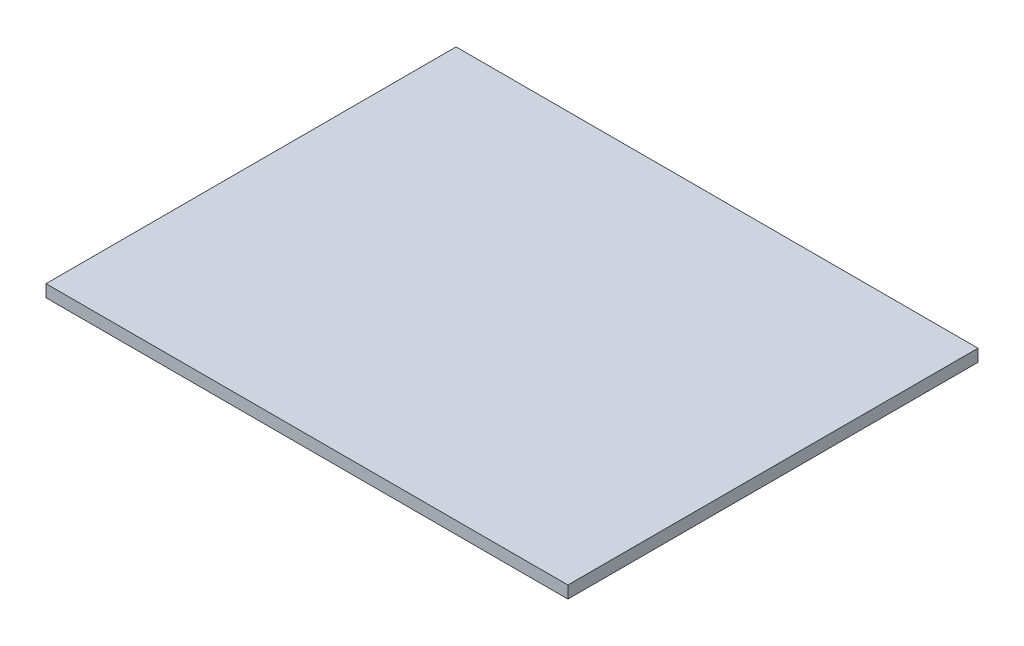
from build123d import *

# Parameters (mm, degrees)
SKETCH1_W           = 270.7
SKETCH1_H           = 212.7
BOSS_EXTRUDE1_DEPTH = 6.35


with BuildPart() as part:
    # Sketch1 → Boss-Extrude1 (new body)
    with BuildSketch(Plane(origin=(0, 0, 0), x_dir=(1, 0, 0), z_dir=(0, 1, 0))):
        Rectangle(SKETCH1_W, SKETCH1_H)
    extrude(amount=BOSS_EXTRUDE1_DEPTH)


solid = part.part
